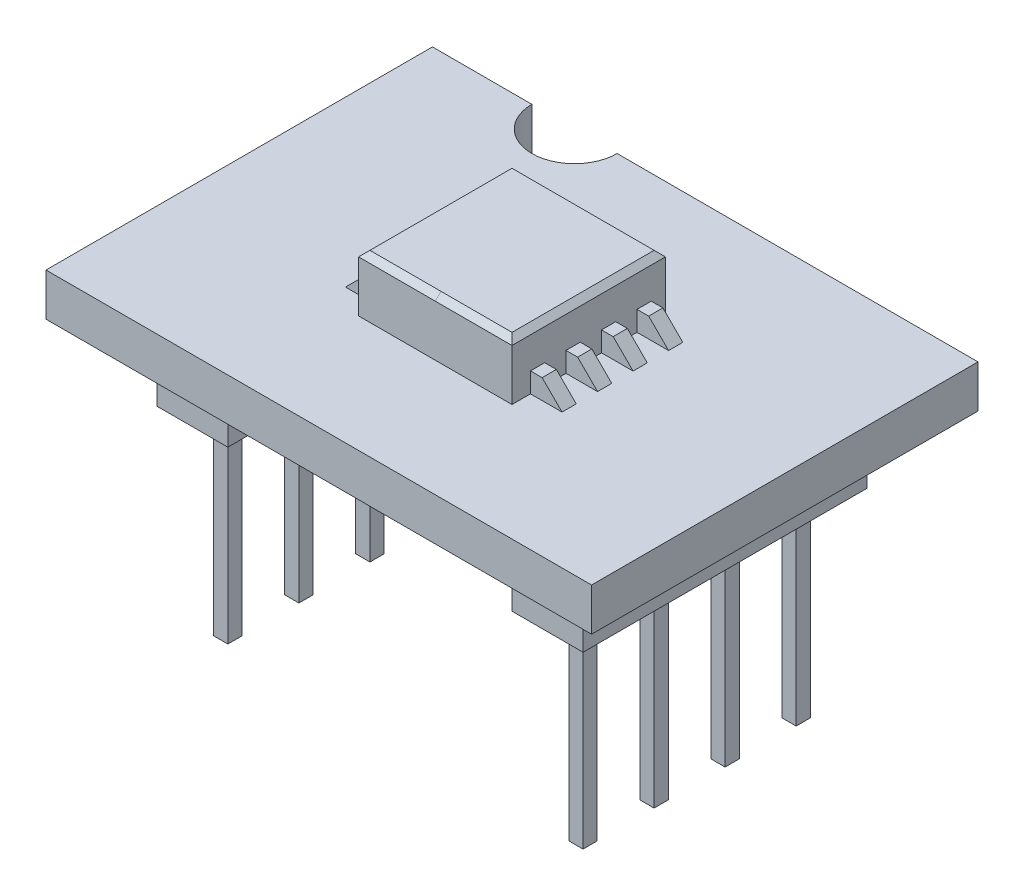
from build123d import *

# Parameters (mm, degrees)
BOSS_EXTRUDE1_DEPTH        = 1.5
SKETCH2_W                  = 2.7
SKETCH2_H                  = 5.4
BOSS_EXTRUDE2_DEPTH        = 2
CHAMFER1_SIZE              = 0.2
SKETCH3_W                  = 1.410498469
SKETCH3_H                  = 0.5
BOSS_EXTRUDE3_DEPTH        = 0.7
CHAMFER2_SIZE              = 1
LPATTERN2_COUNT            = 4
LPATTERN2_PITCH            = 1.25
CHAMFER2_OF_LPATTERN2_SIZE = 1
MIRROR1_START              = -9.5
MIRROR1_DEPTH              = 5.4
MIRROR1_START_2            = -9
MIRROR1_2_DEPTH            = 0.5
MIRROR1_START_3            = -7.75
MIRROR1_3_DEPTH            = 0.5
MIRROR1_START_4            = -6.5
MIRROR1_4_DEPTH            = 0.5
MIRROR1_START_5            = -5.25
MIRROR1_5_DEPTH            = 0.5
MIRROR1_START_6            = -0.565685425
MIRROR1_6_OUTLINE_W        = 4.6
MIRROR1_6_OUTLINE_H        = 5.050966799
MIRROR1_6_DEPTH            = 1.565685425
MIRROR1_START_7            = -5
MIRROR1_7_OUTLINE_W        = 4.6
MIRROR1_7_OUTLINE_H        = 1.949033201
MIRROR1_7_DEPTH            = 4.434314575
SKETCH5_W                  = 2.5
SKETCH5_H                  = 10
BOSS_EXTRUDE4_DEPTH        = 2.5
SKETCH6_W                  = 0.5
SKETCH6_H                  = 0.5
BOSS_EXTRUDE5_DEPTH        = 7
LPATTERN3_COUNT            = 4
LPATTERN3_PITCH            = 2.5


with BuildPart() as part:
    # Sketch1 → Boss-Extrude1 (new body)
    with BuildSketch(Plane(origin=(0, 0, 0), x_dir=(1, 0, 0), z_dir=(0, 1, 0))):
        with BuildLine():
            Line((-19.2, 0), (0, 0))
            Line((0, 0), (0, 13.6))
            Line((0, 13.6), (-12.7, 13.6))
            ThreePointArc((-12.7, 13.6), (-14.2, 12.1), (-15.7, 13.6))
            Line((-15.7, 13.6), (-19.2, 13.6))
            Line((-19.2, 13.6), (-19.2, 0))
        make_face()
    extrude(amount=BOSS_EXTRUDE1_DEPTH)

    # Sketch2 → Boss-Extrude2 (add)
    with BuildSketch(Plane(origin=(0, 1.5, 0), x_dir=(1, 0, 0), z_dir=(0, 1, 0))):
        with Locations((-10.95, 6.8)):
            Rectangle(SKETCH2_W, SKETCH2_H)
    extrude(amount=BOSS_EXTRUDE2_DEPTH)

    # Chamfer1
    chamfer1_edges = [part.edges().sort_by_distance(p)[0] for p in [
        (-12.3, 3.5, -6.8),
        (-10.95, 3.5, -4.1),
        (-10.95, 3.5, -9.5),
    ]]
    chamfer(chamfer1_edges, length=CHAMFER1_SIZE)

    # Sketch3 → Boss-Extrude3 (add)
    with BuildSketch(Plane(origin=(0, 1.5, 0), x_dir=(1, 0, 0), z_dir=(0, 1, 0))):
        with Locations((-13.005249235, 8.75)):
            Rectangle(SKETCH3_W, SKETCH3_H)
    boss_extrude3 = extrude(amount=BOSS_EXTRUDE3_DEPTH)

    # Chamfer2
    # the kernel refuses this chamfer: 1 mm, written as the material it takes off along each edge
    with BuildSketch(Plane(origin=(-13.710498469, 2.2, -11.571682988), x_dir=(1, 0, 0), z_dir=(0, 0, 1))) as chamfer2_piece_1_section:
        Polygon((CHAMFER2_SIZE, 0), (0, -CHAMFER2_SIZE), (0, 0), align=None)
    chamfer2_piece_1 = extrude(amount=5.643365976, mode=Mode.PRIVATE)
    chamfer2_piece_1 = split(chamfer2_piece_1, bisect_by=Plane(origin=(-13.710498469, 1.5, -11.571682988), z_dir=(0, 1, 0)), keep=Keep.TOP, mode=Mode.PRIVATE)
    add(chamfer2_piece_1, mode=Mode.SUBTRACT)

    # LPattern2: Boss-Extrude3 ×4
    with Locations(*[(0, 0, i * LPATTERN2_PITCH) for i in range(1, LPATTERN2_COUNT)]):
        add(boss_extrude3)

    # Chamfer2 of LPattern2
    # the kernel refuses this chamfer: 1 mm, written as the material it takes off along each edge
    with BuildSketch(Plane(origin=(-13.710498469, 2.2, -10.321682988), x_dir=(1, 0, 0), z_dir=(0, 0, 1))) as chamfer2_of_lpattern2_piece_1_section:
        Polygon((CHAMFER2_OF_LPATTERN2_SIZE, 0), (0, -CHAMFER2_OF_LPATTERN2_SIZE), (0, 0), align=None)
    chamfer2_of_lpattern2_piece_1 = extrude(amount=5.643365976, mode=Mode.PRIVATE)
    chamfer2_of_lpattern2_piece_1 = split(chamfer2_of_lpattern2_piece_1, bisect_by=Plane(origin=(-13.710498469, 1.5, -10.321682988), z_dir=(0, 1, 0)), keep=Keep.TOP, mode=Mode.PRIVATE)
    add(chamfer2_of_lpattern2_piece_1, mode=Mode.SUBTRACT)
    with BuildSketch(Plane(origin=(-13.710498469, 2.2, -9.071682988), x_dir=(1, 0, 0), z_dir=(0, 0, 1))) as chamfer2_of_lpattern2_piece_2_section:
        Polygon((CHAMFER2_OF_LPATTERN2_SIZE, 0), (0, -CHAMFER2_OF_LPATTERN2_SIZE), (0, 0), align=None)
    chamfer2_of_lpattern2_piece_2 = extrude(amount=5.643365976, mode=Mode.PRIVATE)
    chamfer2_of_lpattern2_piece_2 = split(chamfer2_of_lpattern2_piece_2, bisect_by=Plane(origin=(-13.710498469, 1.5, -9.071682988), z_dir=(0, 1, 0)), keep=Keep.TOP, mode=Mode.PRIVATE)
    add(chamfer2_of_lpattern2_piece_2, mode=Mode.SUBTRACT)
    with BuildSketch(Plane(origin=(-13.710498469, 2.2, -7.821682988), x_dir=(1, 0, 0), z_dir=(0, 0, 1))) as chamfer2_of_lpattern2_piece_3_section:
        Polygon((CHAMFER2_OF_LPATTERN2_SIZE, 0), (0, -CHAMFER2_OF_LPATTERN2_SIZE), (0, 0), align=None)
    chamfer2_of_lpattern2_piece_3 = extrude(amount=5.643365976, mode=Mode.PRIVATE)
    chamfer2_of_lpattern2_piece_3 = split(chamfer2_of_lpattern2_piece_3, bisect_by=Plane(origin=(-13.710498469, 1.5, -7.821682988), z_dir=(0, 1, 0)), keep=Keep.TOP, mode=Mode.PRIVATE)
    add(chamfer2_of_lpattern2_piece_3, mode=Mode.SUBTRACT)

    # Mirror1: read off the stored shape, not the designer's step
    # Mirror1 outline → Mirror1 (add)
    with BuildSketch(Plane.XY.offset(MIRROR1_START)):
        Polygon((-6.9, 3.3), (-7.1, 3.5), (-9.6, 3.5), (-9.6, 1.5), (-6.9, 1.5), align=None)
    extrude(amount=MIRROR1_DEPTH)

    # Mirror1 2 outline → Mirror1 2 (add)
    with BuildSketch(Plane.XY.offset(MIRROR1_START_2)):
        Polygon((-6.489501531, 2.2), (-6.9, 2.2), (-6.9, 1.5), (-5.789501531, 1.5), align=None)
    extrude(amount=MIRROR1_2_DEPTH)

    # Mirror1 3 outline → Mirror1 3 (add)
    with BuildSketch(Plane.XY.offset(MIRROR1_START_3)):
        Polygon((-6.489501531, 2.2), (-6.9, 2.2), (-6.9, 1.5), (-5.789501531, 1.5), align=None)
    extrude(amount=MIRROR1_3_DEPTH)

    # Mirror1 4 outline → Mirror1 4 (add)
    with BuildSketch(Plane.XY.offset(MIRROR1_START_4)):
        Polygon((-6.489501531, 2.2), (-6.9, 2.2), (-6.9, 1.5), (-5.789501531, 1.5), align=None)
    extrude(amount=MIRROR1_4_DEPTH)

    # Mirror1 5 outline → Mirror1 5 (add)
    with BuildSketch(Plane.XY.offset(MIRROR1_START_5)):
        Polygon((-6.489501531, 2.2), (-6.9, 2.2), (-6.9, 1.5), (-5.789501531, 1.5), align=None)
    extrude(amount=MIRROR1_5_DEPTH)

    # Mirror1 6 outline → Mirror1 6 (cut)
    with BuildSketch(Plane(origin=(0, 0, 0), x_dir=(1, 0, 0), z_dir=(0, 0.707106781186545, 0.70710678118655)).offset(MIRROR1_START_6)):
        with Locations((-7.3, 6.5254834)):
            Rectangle(MIRROR1_6_OUTLINE_W, MIRROR1_6_OUTLINE_H)
    extrude(amount=MIRROR1_6_DEPTH, mode=Mode.SUBTRACT)

    # Mirror1 7 outline → Mirror1 7 (cut)
    with BuildSketch(Plane(origin=(0, 0, 0), x_dir=(1, 0, 0), z_dir=(0, 0.707106781186545, 0.70710678118655)).offset(MIRROR1_START_7)):
        with Locations((-7.3, 10.0254834)):
            Rectangle(MIRROR1_7_OUTLINE_W, MIRROR1_7_OUTLINE_H)
    extrude(amount=MIRROR1_7_DEPTH, mode=Mode.SUBTRACT)

    # Sketch5 → Boss-Extrude4 (add)
    with BuildSketch(Plane.XZ):
        with Locations((-15.85, -6.8)):
            Rectangle(SKETCH5_W, SKETCH5_H)
        with Locations((-3.35, -6.8)):
            Rectangle(SKETCH5_W, SKETCH5_H)
    extrude(amount=BOSS_EXTRUDE4_DEPTH)

    # Sketch6 → Boss-Extrude5 (add)
    with BuildSketch(Plane.XZ.offset(2.5)):
        with Locations((-15.85, -3.05)):
            Rectangle(SKETCH6_W, SKETCH6_H)
        with Locations((-3.35, -3.05)):
            Rectangle(SKETCH6_W, SKETCH6_H)
    boss_extrude5 = extrude(amount=BOSS_EXTRUDE5_DEPTH)

    # LPattern3: Boss-Extrude5 ×4
    with Locations(*[(0, 0, -i * LPATTERN3_PITCH) for i in range(1, LPATTERN3_COUNT)]):
        add(boss_extrude5)


solid = part.part
